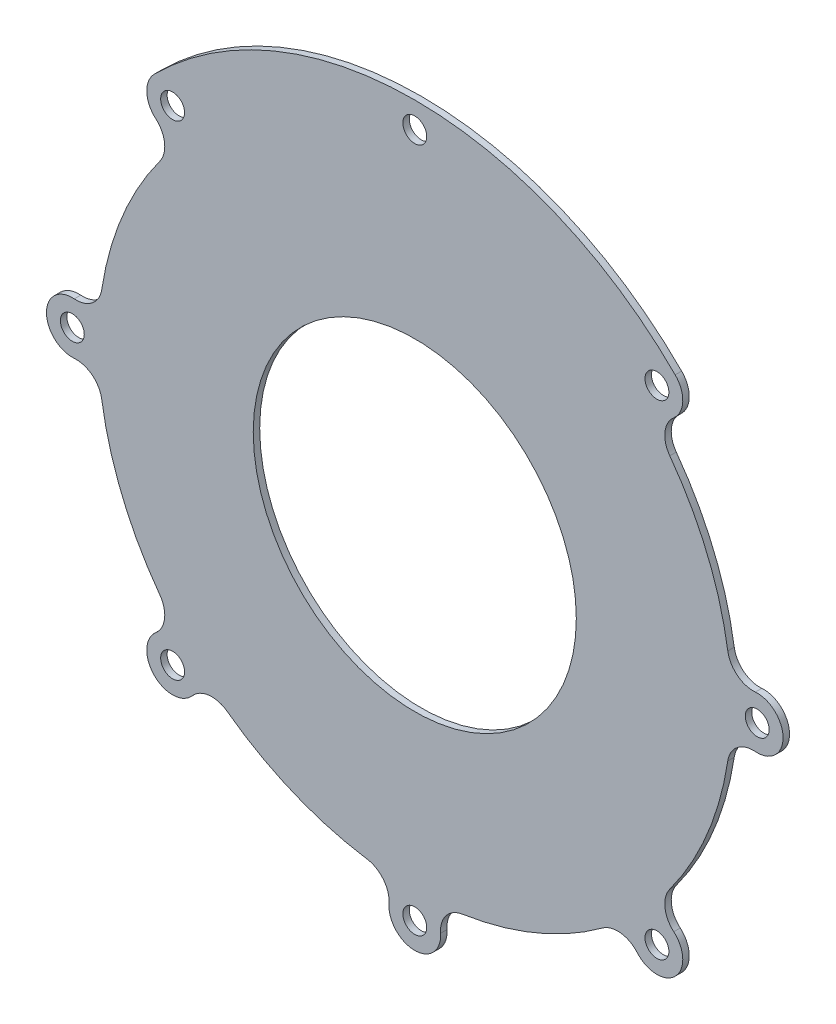
from build123d import *

# Parameters (mm, degrees)
SKETCH1_R           = 1.85
SKETCH1_R_2         = 25
BOSS_EXTRUDE1_DEPTH = 1


with BuildPart() as part:
    # Sketch1 → Boss-Extrude1 (new body)
    with BuildSketch(Plane.XY):
        with BuildLine():
            ThreePointArc((-40.083553498, 34.442832912), (-38.716100837, 31.861298217), (-39.46852702, 29.03851537))
            ThreePointArc((-39.46852702, 29.03851537), (-45.270097093, 18.751488186), (-48.441794233, 7.375131965))
            ThreePointArc((-48.441794233, 7.375131965), (-49.90575747, 4.847077417), (-52.698113208, 3.988591777))
            ThreePointArc((-52.698113208, 3.988591777), (-57, 0), (-52.698113208, -3.988591777))
            ThreePointArc((-52.698113208, -3.988591777), (-49.90575747, -4.847077417), (-48.441794233, -7.375131965))
            ThreePointArc((-48.441794233, -7.375131965), (-45.270097093, -18.751488186), (-39.46852702, -29.03851537))
            ThreePointArc((-39.46852702, -29.03851537), (-38.716100837, -31.861298217), (-40.083553498, -34.442832912))
            ThreePointArc((-40.083553498, -34.442832912), (-40.305086528, -40.305086528), (-34.442832912, -40.083553498))
            ThreePointArc((-34.442832912, -40.083553498), (-31.861298217, -38.716100837), (-29.03851537, -39.46852702))
            ThreePointArc((-29.03851537, -39.46852702), (-18.751488186, -45.270097093), (-7.375131965, -48.441794233))
            ThreePointArc((-7.375131965, -48.441794233), (-4.847077417, -49.90575747), (-3.988591777, -52.698113208))
            ThreePointArc((-3.988591777, -52.698113208), (0, -57), (3.988591777, -52.698113208))
            ThreePointArc((3.988591777, -52.698113208), (4.847077417, -49.90575747), (7.375131965, -48.441794233))
            ThreePointArc((7.375131965, -48.441794233), (18.751488186, -45.270097093), (29.03851537, -39.46852702))
            ThreePointArc((29.03851537, -39.46852702), (31.861298217, -38.716100837), (34.442832912, -40.083553498))
            ThreePointArc((34.442832912, -40.083553498), (40.305086528, -40.305086528), (40.083553498, -34.442832912))
            ThreePointArc((40.083553498, -34.442832912), (38.716100837, -31.861298217), (39.46852702, -29.03851537))
            ThreePointArc((39.46852702, -29.03851537), (45.270097093, -18.751488186), (48.441794233, -7.375131965))
            ThreePointArc((48.441794233, -7.375131965), (49.90575747, -4.847077417), (52.698113208, -3.988591777))
            ThreePointArc((52.698113208, -3.988591777), (57, 0), (52.698113208, 3.988591777))
            ThreePointArc((52.698113208, 3.988591777), (49.90575747, 4.847077417), (48.441794233, 7.375131965))
            ThreePointArc((48.441794233, 7.375131965), (45.270097093, 18.751488186), (39.46852702, 29.03851537))
            ThreePointArc((39.46852702, 29.03851537), (38.716100837, 31.861298217), (40.083553498, 34.442832912))
            ThreePointArc((40.083553498, 34.442832912), (41.47380633, 37.325608267), (40.305086528, 40.305086528))
            ThreePointArc((40.305086528, 40.305086528), (37.148240852, 43.232027498), (33.779497471, 45.912368166))
            ThreePointArc((33.779497471, 45.912368166), (-4.301886792, 56.837432824), (-40.305086528, 40.305086528))
            ThreePointArc((-40.305086528, 40.305086528), (-41.47380633, 37.325608267), (-40.083553498, 34.442832912))
        make_face()
        with Locations((-37.476659403, -37.476659403)):
            Circle(SKETCH1_R, mode=Mode.SUBTRACT)
        with Locations((-53, 0)):
            Circle(SKETCH1_R, mode=Mode.SUBTRACT)
        with Locations((0, -53)):
            Circle(SKETCH1_R, mode=Mode.SUBTRACT)
        with Locations((37.476659403, -37.476659403)):
            Circle(SKETCH1_R, mode=Mode.SUBTRACT)
        Circle(SKETCH1_R_2, mode=Mode.SUBTRACT)
        with Locations((53, 0)):
            Circle(SKETCH1_R, mode=Mode.SUBTRACT)
        with Locations((-37.476659403, 37.476659403)):
            Circle(SKETCH1_R, mode=Mode.SUBTRACT)
        with Locations((37.476659403, 37.476659403)):
            Circle(SKETCH1_R, mode=Mode.SUBTRACT)
        with Locations((0, 53)):
            Circle(SKETCH1_R, mode=Mode.SUBTRACT)
    extrude(amount=BOSS_EXTRUDE1_DEPTH)


solid = part.part
